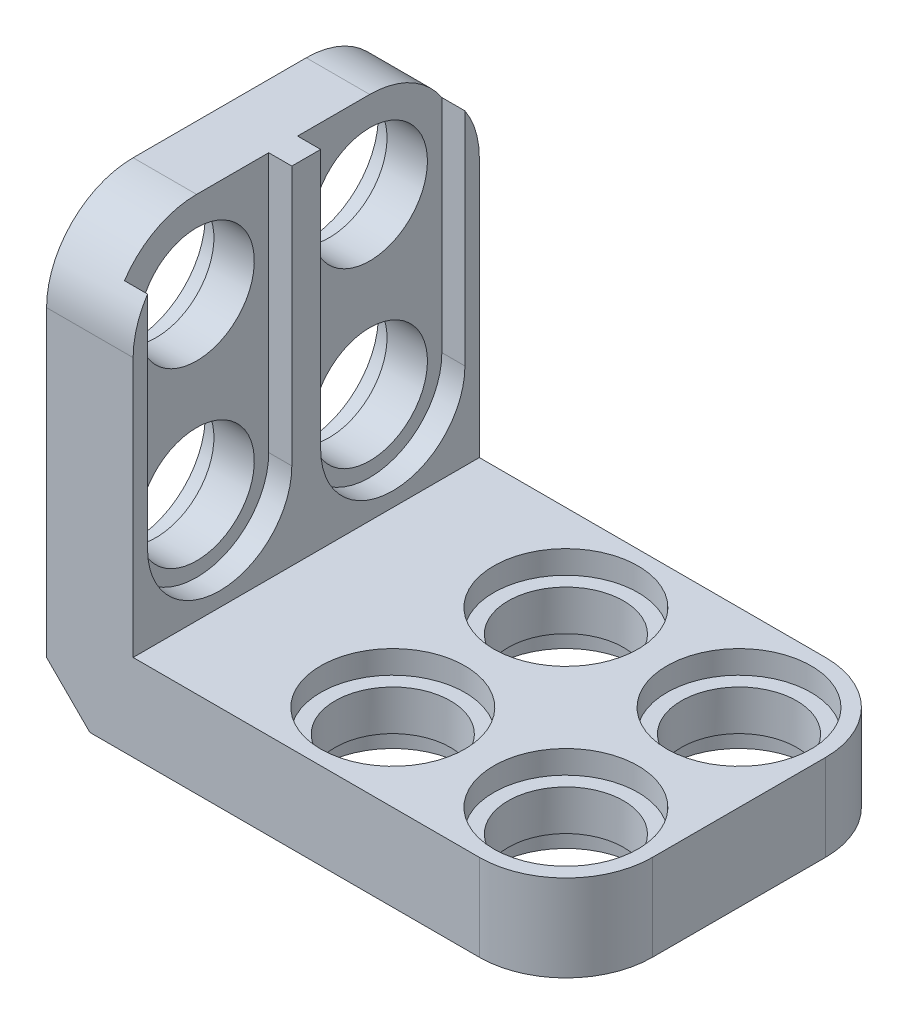
from build123d import *

# Parameters (mm, degrees)
BOSS_EXTRUDE1_DEPTH = 6
HOLE2_D             = 4
HOLE2_DEPTH         = 3
HOLE2_CBORE_D       = 5
HOLE2_CBORE_DEPTH   = 0.8
HOLE2_TIP           = 1.201721238
HOLE3_D             = 4
HOLE3_DEPTH         = 18
HOLE3_CBORE_D       = 5
HOLE3_CBORE_DEPTH   = 0.8
HOLE3_TIP           = 1.201721238
CUT_EXTRUDE1_START  = -0.8
CUT_EXTRUDE1_DEPTH  = 0.8
CUT_EXTRUDE2_START  = -0.8
SKETCH12_R          = 2.5
CUT_EXTRUDE2_DEPTH  = 0.8
SKETCH14_R          = 2.35
CUT_EXTRUDE3_DEPTH  = 0.8
CHAMFER1_SIZE       = 1.5
FILLET1_R           = 3


with BuildPart() as part:
    # Sketch1 → Boss-Extrude1 (new, symmetric)
    with BuildSketch(Plane.XY):
        Polygon((0, 7.5), (0, -7.5), (18, -7.5), (18, -4.5), (3, -4.5), (3, 7.5), align=None)
    extrude(amount=BOSS_EXTRUDE1_DEPTH, both=True)

    # Hole2
    with Locations(Plane(origin=(0, -4.5, 0), x_dir=(1, 0, 0), z_dir=(0, 1, 0))):
        with Locations((15, 3), (9, 3), (9, -3), (15, -3)):
            CounterBoreHole(HOLE2_D / 2, HOLE2_CBORE_D / 2, HOLE2_CBORE_DEPTH, depth=HOLE2_DEPTH)
            with Locations((0, 0, -(HOLE2_DEPTH + HOLE2_TIP / 2))):  # 118° drill point
                Cone(0, HOLE2_D / 2, HOLE2_TIP, mode=Mode.SUBTRACT)

    # Hole3
    with Locations(Plane.ZY):
        with Locations((3, -1.5), (-3, -1.5), (3, 4.5), (-3, 4.5)):
            CounterBoreHole(HOLE3_D / 2, HOLE3_CBORE_D / 2, HOLE3_CBORE_DEPTH, depth=HOLE3_DEPTH)
            with Locations((0, 0, -(HOLE3_DEPTH + HOLE3_TIP / 2))):  # 118° drill point
                Cone(0, HOLE3_D / 2, HOLE3_TIP, mode=Mode.SUBTRACT)

    # Sketch11 → Cut-Extrude1 (cut)
    with BuildSketch(Plane(origin=(3, 0, 0), x_dir=(0, 0, -1), z_dir=(1, 0, 0)).offset(CUT_EXTRUDE1_START)):
        with BuildLine():
            Line((5.5, -1.5), (5.5, 7.5))
            Line((5.5, 7.5), (0.5, 7.5))
            Line((0.5, 7.5), (0.5, -1.5))
            ThreePointArc((0.5, -1.5), (3, -4), (5.5, -1.5))
        make_face()
    cut_extrude1 = extrude(amount=CUT_EXTRUDE1_DEPTH, mode=Mode.SUBTRACT)

    # Sketch12 → Cut-Extrude2 (cut)
    with BuildSketch(Plane(origin=(0, -7.5, 0), x_dir=(-1, 0, 0), z_dir=(0, -1, 0)).offset(CUT_EXTRUDE2_START)):
        with Locations(Location((-9, 3, 0), (0, 0, 270))):
            Circle(SKETCH12_R)
        with Locations(Location((-15, 3, 0), (0, 0, 270))):
            Circle(SKETCH12_R)
        with BuildLine():
            Line((-3, 0.5), (0, 0.5))
            Line((0, 0.5), (0, 5.5))
            Line((0, 5.5), (-3, 5.5))
            ThreePointArc((-3, 5.5), (-5.5, 3), (-3, 0.5))
        make_face()
    cut_extrude2 = extrude(amount=CUT_EXTRUDE2_DEPTH, mode=Mode.SUBTRACT)

    # Sketch14 → Cut-Extrude3 (cut)
    with BuildSketch(Plane.ZY):
        with Locations((-3, -7.5)):
            Circle(SKETCH14_R)
    cut_extrude3 = extrude(amount=-CUT_EXTRUDE3_DEPTH, mode=Mode.SUBTRACT)

    # Mirror1: Cut-Extrude1, Cut-Extrude2, Cut-Extrude3 across plane
    add(cut_extrude1.mirror(Plane.XY), mode=Mode.SUBTRACT)
    add(cut_extrude2.mirror(Plane.XY), mode=Mode.SUBTRACT)
    add(cut_extrude3.mirror(Plane.XY), mode=Mode.SUBTRACT)

    # Chamfer1
    # the kernel refuses this chamfer: 1.5 mm, written as the material it takes off along each edge
    with BuildSketch(Plane(origin=(0, -7.5, 1.642475518), x_dir=(-0.027495876610586376, 0.9996219169112968, 0), z_dir=(0, 0, 1)), Plane(origin=(0, -7.5, -9.857524482), x_dir=(-0.027495876610586376, 0.9996219169112968, 0), z_dir=(0, 0, 1))) as chamfer1_piece_1:
        Polygon((CHAMFER1_SIZE * 0.999621916911, -CHAMFER1_SIZE * 0.0274958766106), (-CHAMFER1_SIZE * 0.0274958766106, -CHAMFER1_SIZE * 0.999621916911), (0, 0), align=None)
    extrude(amount=8.215048964, mode=Mode.SUBTRACT)
    with BuildSketch(Plane(origin=(0, -7.5, -4.357524482), x_dir=(-0.027495876610586376, 0.9996219169112968, 0), z_dir=(0, 0, 1))) as chamfer1_piece_2:
        Polygon((CHAMFER1_SIZE * 0.999621916911, -CHAMFER1_SIZE * 0.0274958766106), (-CHAMFER1_SIZE * 0.0274958766106, -CHAMFER1_SIZE * 0.999621916911), (0, 0), align=None)
    extrude(amount=8.715048964, mode=Mode.SUBTRACT)

    # Fillet1
    fillet1_edges = [part.edges().sort_by_distance(p)[0] for p in [
        (18, -6, 6),
        (18, -6, -6),
        (1.5, 7.5, 6),
        (1.5, 7.5, -6),
    ]]
    fillet(fillet1_edges, radius=FILLET1_R)


solid = part.part
